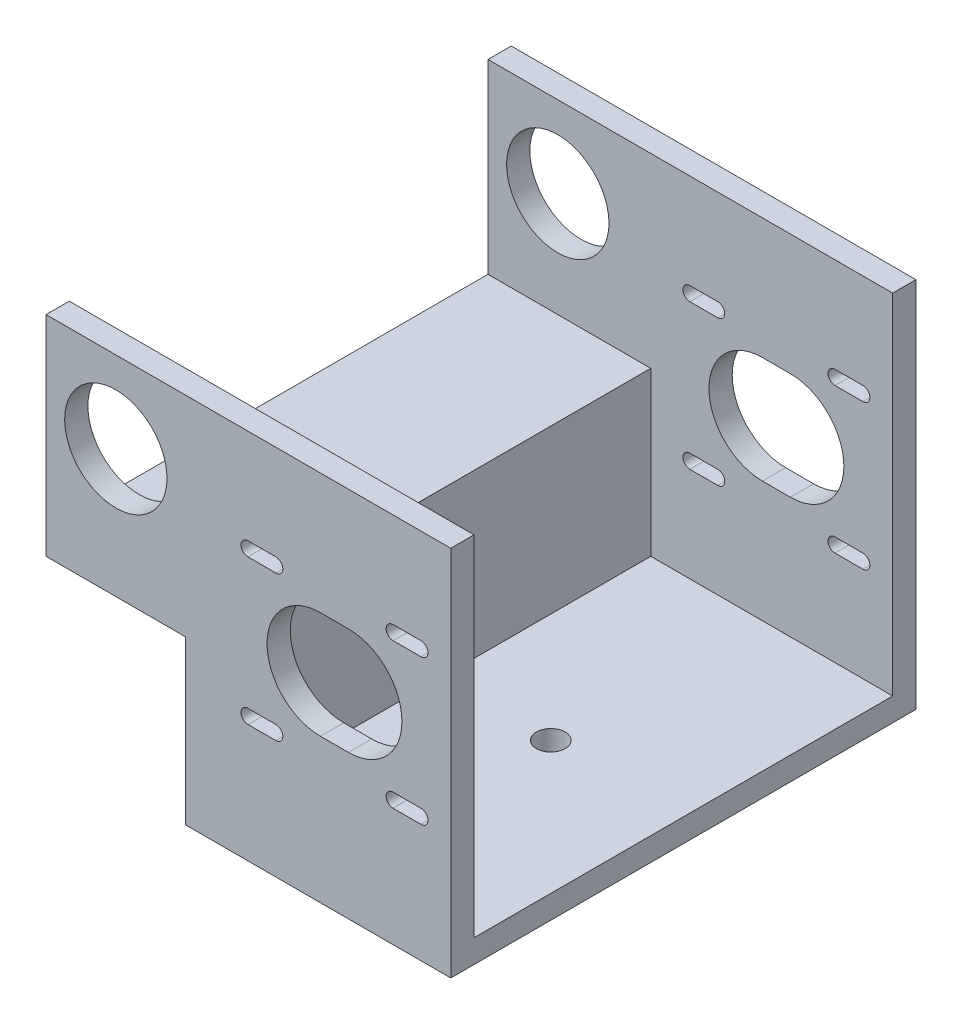
from build123d import *

# Parameters (mm, degrees)
SKETCH1_W           = 57
SKETCH1_H           = 100
BOSS_EXTRUDE1_DEPTH = 80
SKETCH3_W           = 75
SKETCH3_H           = 90
CUT_EXTRUDE1_DEPTH  = 52
SKETCH4_R           = 3.1
CUT_EXTRUDE2_DEPTH  = 114.213294272
BOSS_EXTRUDE2_DEPTH = 30
CUT_EXTRUDE5_REACH  = 112.223
SKETCH8_W           = 90
SKETCH8_H           = 40
SKETCH5_R           = 11
CUT_EXTRUDE3_DEPTH  = 141.791512528


with BuildPart() as part:
    # Sketch1 → Boss-Extrude1 (new body)
    with BuildSketch(Plane(origin=(0, 0, 0), x_dir=(1, 0, 0), z_dir=(0, 1, 0))):
        Rectangle(SKETCH1_W, SKETCH1_H)
    extrude(amount=BOSS_EXTRUDE1_DEPTH)

    # Sketch3 → Cut-Extrude1 (cut)
    with BuildSketch(Plane(origin=(28.5, 40, 0), x_dir=(0, 1, 0), z_dir=(-1, 0, 0))):
        with Locations((2.5, 0)):
            Rectangle(SKETCH3_W, SKETCH3_H)
    extrude(amount=CUT_EXTRUDE1_DEPTH, mode=Mode.SUBTRACT)

    # Sketch4 → Cut-Extrude2 (cut, through all)
    with BuildSketch(Plane(origin=(-40, 5, 0), x_dir=(-1, 0, 0), z_dir=(0, -1, 0))):
        with Locations((-40, 0)):
            Circle(SKETCH4_R)
    extrude(amount=CUT_EXTRUDE2_DEPTH, mode=Mode.SUBTRACT)

    # Sketch7 → Boss-Extrude2 (add)
    with BuildSketch(Plane.ZY.offset(28.5)):
        Polygon((-50, 80), (-45, 80), (-45, 40), (45, 40), (45, 80), (50, 80), (50, 35), (-50, 35), align=None)
    extrude(amount=BOSS_EXTRUDE2_DEPTH)

    # Sketch8 → Cut-Extrude5 (cut, up to next)
    with BuildSketch(Plane.ZY.offset(28.5), mode=Mode.PRIVATE) as cut_extrude5_sk1:
        with Locations((0, 60)):
            Rectangle(SKETCH8_W, SKETCH8_H)
    cut_extrude5_tool1 = extrude(cut_extrude5_sk1.sketch, amount=-CUT_EXTRUDE5_REACH, mode=Mode.PRIVATE) & part.part
    add(cut_extrude5_tool1.solids().sort_by_distance((-28.5, 60, 0))[0], mode=Mode.SUBTRACT)

    # Sketch5 → Cut-Extrude3 (cut, through all)
    with BuildSketch(Plane(origin=(0, 0, -50), x_dir=(-1, 0, 0), z_dir=(0, 0, -1))):
        with Locations((43.5, 62.5)):
            Circle(SKETCH5_R)
        with BuildLine():
            Line((-22.1, 59.6), (-16.1, 59.6))
            ThreePointArc((-16.1, 59.6), (-14.6, 58.1), (-16.1, 56.6))
            Line((-16.1, 56.6), (-22.1, 56.6))
            ThreePointArc((-22.1, 56.6), (-23.6, 58.1), (-22.1, 59.6))
        make_face()
        with BuildLine():
            Line((-0.5, 31), (-6.5, 31))
            ThreePointArc((-6.5, 31), (-18, 42.5), (-6.5, 54))
            Line((-6.5, 54), (-0.5, 54))
            ThreePointArc((-0.5, 54), (11, 42.5), (-0.5, 31))
        make_face()
        with BuildLine():
            Line((-22.1, 25.4), (-16.1, 25.4))
            ThreePointArc((-16.1, 25.4), (-14.6, 26.9), (-16.1, 28.4))
            Line((-16.1, 28.4), (-22.1, 28.4))
            ThreePointArc((-22.1, 28.4), (-23.6, 26.9), (-22.1, 25.4))
        make_face()
        with BuildLine():
            Line((15.1, 25.4), (9.1, 25.4))
            ThreePointArc((9.1, 25.4), (7.6, 26.9), (9.1, 28.4))
            Line((9.1, 28.4), (15.1, 28.4))
            ThreePointArc((15.1, 28.4), (16.6, 26.9), (15.1, 25.4))
        make_face()
        with BuildLine():
            Line((15.1, 59.6), (9.1, 59.6))
            ThreePointArc((9.1, 59.6), (7.6, 58.1), (9.1, 56.6))
            Line((9.1, 56.6), (15.1, 56.6))
            ThreePointArc((15.1, 56.6), (16.6, 58.1), (15.1, 59.6))
        make_face()
    extrude(amount=-CUT_EXTRUDE3_DEPTH, mode=Mode.SUBTRACT)


solid = part.part
